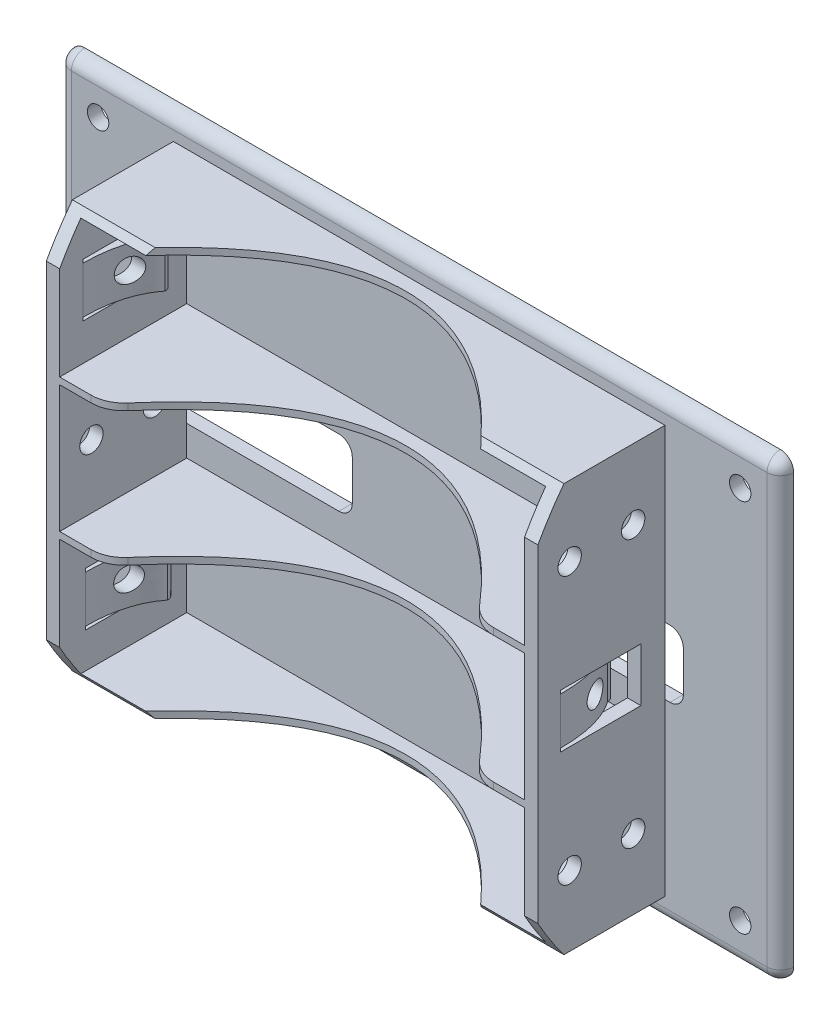
from build123d import *

# Parameters (mm, degrees)
SZKIC1_W                        = 108
SZKIC1_H                        = 68
DODANIE_WYCI_GNI_CIE1_DEPTH     = 2
SZKIC2_W                        = 69.5
SZKIC2_H                        = 1
DODANIE_WYCI_GNI_CIE2_DEPTH     = 19
SZKIC4_W                        = 12
SZKIC4_H                        = 8
WYTNIJ_WYCI_GNI_CIE1_DEPTH      = 2
SZKIC5_W                        = 12
SZKIC5_H                        = 8
WYTNIJ_WYCI_GNI_CIE2_DEPTH      = 2
DODANIE_WYCI_GNI_CIE3_START     = 0.5
DODANIE_WYCI_GNI_CIE3_DEPTH     = 7
DODANIE_WYCI_GNI_CIE4_START     = 0.5
DODANIE_WYCI_GNI_CIE4_DEPTH     = 7
DODANIE_WYCI_GNI_CIE5_START     = 0.5
DODANIE_WYCI_GNI_CIE5_DEPTH     = 7
WYTNIJ_WYCI_GNI_CIE3_DEPTH      = 67
ZAOKR_GLENIE2_R                 = 5
WYTNIJ_WYCI_GNI_CIE5_DEPTH      = 10
WYTNIJ_WYCI_GNI_CIE5_DEPTH_BACK = 10
SZKIC10_R                       = 1.75
WYTNIJ_WYCI_GNI_CIE6_DEPTH      = 10
WYTNIJ_WYCI_GNI_CIE6_DEPTH_BACK = 10
SZKIC11_R                       = 1.75
SZKIC13_W                       = 29.5
SZKIC13_H                       = 10
SZKIC13_R                       = 1.6
WYTNIJ_WYCI_GNI_CIE7_DEPTH      = 2
ZAOKR_GLENIE4_R                 = 2
WYTNIJ_WYCI_GNI_CIE8_START      = -90.75
WYTNIJ_WYCI_GNI_CIE8_DEPTH      = 108


with BuildPart() as part:
    # Szkic1 → Dodanie-wyciągnięcie1 (new body)
    with BuildSketch(Plane.XY):
        with Locations((19.733950025, 34.841198491)):
            Rectangle(SZKIC1_W, SZKIC1_H)
    extrude(amount=DODANIE_WYCI_GNI_CIE1_DEPTH)

    # Szkic2 → Dodanie-wyciągnięcie2 (add)
    with BuildSketch(Plane.XY.offset(2)):
        Polygon((-17.016049975, 65.341198491), (-15.016049975, 65.341198491), (-15.016049975, 64.341198491), (-15.016049975, 45.341198491), (-15.016049975, 44.341198491), (-15.016049975, 34.841198491), (-15.016049975, 25.341198491), (-15.016049975, 24.341198491), (-15.016049975, 5.341198491), (-15.016049975, 4.341198491), (-17.016049975, 4.341198491), align=None)
        Polygon((56.483950025, 4.341198491), (56.483950025, 65.341198491), (54.483950025, 65.341198491), (54.483950025, 64.341198491), (54.483950025, 45.341198491), (54.483950025, 44.341198491), (54.483950025, 34.841198491), (54.483950025, 25.341198491), (54.483950025, 24.341198491), (54.483950025, 5.341198491), (54.483950025, 4.341198491), align=None)
        with Locations((19.733950025, 44.841198491)):
            Rectangle(SZKIC2_W, SZKIC2_H)
        with Locations((19.733950025, 64.841198491)):
            Rectangle(SZKIC2_W, SZKIC2_H)
        with Locations((19.733950025, 24.841198491)):
            Rectangle(SZKIC2_W, SZKIC2_H)
        with Locations((19.733950025, 4.841198491)):
            Rectangle(SZKIC2_W, SZKIC2_H)
    extrude(amount=DODANIE_WYCI_GNI_CIE2_DEPTH)

    # Szkic4 → Wytnij-wyciągnięcie1 (cut)
    with BuildSketch(Plane(origin=(-15.016049975, 0, 0), x_dir=(0, 0, -1), z_dir=(1, 0, 0))):
        with Locations((-11.5, 54.841198491)):
            Rectangle(SZKIC4_W, SZKIC4_H)
        with Locations((-11.1, 14.641198491)):
            Rectangle(SZKIC4_W, SZKIC4_H)
    extrude(amount=-WYTNIJ_WYCI_GNI_CIE1_DEPTH, mode=Mode.SUBTRACT)

    # Szkic5 → Wytnij-wyciągnięcie2 (cut)
    with BuildSketch(Plane.ZY.offset(-54.483950025)):
        with Locations((11.6, 34.841198491)):
            Rectangle(SZKIC5_W, SZKIC5_H)
    extrude(amount=-WYTNIJ_WYCI_GNI_CIE2_DEPTH, mode=Mode.SUBTRACT)

    # Szkic6 → Dodanie-wyciągnięcie3 (add)
    with BuildSketch(Plane.XZ.offset(-58.841198491).offset(DODANIE_WYCI_GNI_CIE3_START)):
        with BuildLine():
            add(Edge.make_bspline(
                [(-17.016049975, 17.5), (-17.016049975, 12.133436854), (-15.016049975, 8.766873708)],
                knots=[0, 0, 0, 0.894427191, 0.894427191, 0.894427191], degree=2))
            Line((-15.016049975, 8.766873708), (-15.016049975, 17.5))
            Line((-15.016049975, 17.5), (-17.016049975, 17.5))
        make_face()
        with BuildLine():
            add(Edge.make_bspline(
                [(-15.016049975, 8.766873708), (-14.779981997, 8.369504832), (-14.516049975, 8)],
                knots=[0.894427191, 0.894427191, 0.894427191, 1, 1, 1], degree=2))
            ThreePointArc((-14.516049975, 8), (-14.032436394, 8.924255625), (-12.997386045, 9.053875567))
            add(Edge.make_bspline(
                [(-15.016049975, 17.5), (-15.016049975, 12.35936327), (-12.997386045, 9.053875567)],
                knots=[0, 0, 0, 0.856772788, 0.856772788, 0.856772788], degree=2))
            Line((-15.016049975, 17.5), (-15.016049975, 8.766873708))
        make_face()
        with BuildLine():
            ThreePointArc((-12.997386045, 9.053875567), (-14.032436394, 8.924255625), (-14.516049975, 8))
            Line((-14.516049975, 8), (-12.266049975, 8))
            add(Edge.make_bspline(
                [(-12.997386045, 9.053875567), (-12.659924807, 8.501295241), (-12.266049975, 8)],
                knots=[0.856772788, 0.856772788, 0.856772788, 1, 1, 1], degree=2))
        make_face()
        with BuildLine():
            Line((-12.266049975, 8), (-14.516049975, 8))
            ThreePointArc((-14.516049975, 8), (-13.391049975, 6.875), (-12.266049975, 8))
        make_face()
    extrude(amount=DODANIE_WYCI_GNI_CIE3_DEPTH)

    # Szkic7 → Dodanie-wyciągnięcie4 (add)
    with BuildSketch(Plane.XZ.offset(-18.641198491).offset(DODANIE_WYCI_GNI_CIE4_START)):
        with BuildLine():
            ThreePointArc((-12.997386045, 8.653875567), (-14.032436394, 8.524255625), (-14.516049975, 7.6))
            Line((-14.516049975, 7.6), (-12.266049975, 7.6))
            add(Edge.make_bspline(
                [(-12.266049975, 7.6), (-12.659924807, 8.101295241), (-12.997386045, 8.653875567)],
                knots=[0, 0, 0, 0.143227212, 0.143227212, 0.143227212], degree=2))
        make_face()
        with BuildLine():
            Line((-12.266049975, 7.6), (-14.516049975, 7.6))
            ThreePointArc((-14.516049975, 7.6), (-13.391049975, 6.475), (-12.266049975, 7.6))
        make_face()
        with BuildLine():
            add(Edge.make_bspline(
                [(-14.516049975, 7.6), (-14.779981997, 7.969504832), (-15.016049975, 8.366873708)],
                knots=[0, 0, 0, 0.105572809, 0.105572809, 0.105572809], degree=2))
            ThreePointArc((-14.516049975, 7.6), (-14.032436394, 8.524255625), (-12.997386045, 8.653875567))
            add(Edge.make_bspline(
                [(-12.997386045, 8.653875567), (-15.016049975, 11.95936327), (-15.016049975, 17.1)],
                knots=[0.143227212, 0.143227212, 0.143227212, 1, 1, 1], degree=2))
            Line((-15.016049975, 17.1), (-15.016049975, 8.366873708))
        make_face()
        with BuildLine():
            add(Edge.make_bspline(
                [(-15.016049975, 8.366873708), (-17.016049975, 11.733436854), (-17.016049975, 17.1)],
                knots=[0.105572809, 0.105572809, 0.105572809, 1, 1, 1], degree=2))
            Line((-15.016049975, 8.366873708), (-15.016049975, 17.1))
            Line((-15.016049975, 17.1), (-17.016049975, 17.1))
        make_face()
    extrude(amount=DODANIE_WYCI_GNI_CIE4_DEPTH)

    # Szkic8 → Dodanie-wyciągnięcie5 (add)
    with BuildSketch(Plane(origin=(0, 30.841198491, 0), x_dir=(1, 0, 0), z_dir=(0, 1, 0)).offset(DODANIE_WYCI_GNI_CIE5_START)):
        with BuildLine():
            add(Edge.make_bspline(
                [(54.483950025, -8.866873708), (54.247882048, -8.469504832), (53.983950025, -8.1)],
                knots=[0.894427191, 0.894427191, 0.894427191, 1, 1, 1], degree=2))
            ThreePointArc((53.983950025, -8.1), (53.500336445, -9.024255625), (52.465286096, -9.153875567))
            add(Edge.make_bspline(
                [(54.483950025, -17.6), (54.483950025, -12.45936327), (52.465286096, -9.153875567)],
                knots=[0, 0, 0, 0.856772788, 0.856772788, 0.856772788], degree=2))
            Line((54.483950025, -17.6), (54.483950025, -8.866873708))
        make_face()
        with BuildLine():
            add(Edge.make_bspline(
                [(56.483950025, -17.6), (56.483950025, -12.233436854), (54.483950025, -8.866873708)],
                knots=[0, 0, 0, 0.894427191, 0.894427191, 0.894427191], degree=2))
            Line((54.483950025, -8.866873708), (54.483950025, -17.6))
            Line((54.483950025, -17.6), (56.483950025, -17.6))
        make_face()
        with BuildLine():
            ThreePointArc((52.465286096, -9.153875567), (53.500336445, -9.024255625), (53.983950025, -8.1))
            Line((53.983950025, -8.1), (51.733950025, -8.1))
            add(Edge.make_bspline(
                [(52.465286096, -9.153875567), (52.127824857, -8.601295241), (51.733950025, -8.1)],
                knots=[0.856772788, 0.856772788, 0.856772788, 1, 1, 1], degree=2))
        make_face()
        with BuildLine():
            Line((51.733950025, -8.1), (53.983950025, -8.1))
            ThreePointArc((53.983950025, -8.1), (52.858950025, -6.975), (51.733950025, -8.1))
        make_face()
    extrude(amount=DODANIE_WYCI_GNI_CIE5_DEPTH)

    # Szkic9 → Wytnij-wyciągnięcie3 (cut)
    with BuildSketch(Plane(origin=(0, 65.341198491, 0), x_dir=(1, 0, 0), z_dir=(0, 1, 0))):
        with BuildLine():
            Line((47.483950025, -21), (-8.016049975, -21))
            add(Edge.make_bspline(
                [(47.483950025, -21), (19.733950025, 13), (-8.016049975, -21)],
                knots=[0, 0, 0, 1, 1, 1], degree=2))
        make_face()
    extrude(amount=-WYTNIJ_WYCI_GNI_CIE3_DEPTH, mode=Mode.SUBTRACT)

    # Zaokrąglenie2
    zaokr_glenie2_edges = [part.edges().sort_by_distance(p)[0] for p in [
        (47.483950025, 64.841198491, 21),
        (-8.016049975, 64.841198491, 21),
        (-8.016049975, 44.841198491, 21),
        (47.483950025, 44.841198491, 21),
        (-8.016049975, 24.841198491, 21),
        (47.483950025, 24.841198491, 21),
        (-8.016049975, 4.841198491, 21),
        (47.483950025, 4.841198491, 21),
    ]]
    fillet(zaokr_glenie2_edges, radius=ZAOKR_GLENIE2_R)

    # Szkic10 → Wytnij-wyciągnięcie5 (cut, two sides: drawn at the far end of the back side and taken through both)
    with BuildSketch(Plane.ZY.offset(-54.483950025).offset(-WYTNIJ_WYCI_GNI_CIE5_DEPTH_BACK)):
        with Locations((6.75, 14.841198491)):
            Circle(SZKIC10_R)
        with Locations((16.25, 14.841198491)):
            Circle(SZKIC10_R)
        with Locations((6.75, 54.841198491)):
            Circle(SZKIC10_R)
        with Locations((16.25, 54.841198491)):
            Circle(SZKIC10_R)
        with Locations(Location((11.5, 34.841198491, 0), (0, 0, 180))):
            Circle(SZKIC10_R)
    extrude(amount=WYTNIJ_WYCI_GNI_CIE5_DEPTH + WYTNIJ_WYCI_GNI_CIE5_DEPTH_BACK, mode=Mode.SUBTRACT)

    # Szkic11 → Wytnij-wyciągnięcie6 (cut, two sides: drawn at the far end of the back side and taken through both)
    with BuildSketch(Plane(origin=(-15.016049975, 0, 0), x_dir=(0, 0, -1), z_dir=(1, 0, 0)).offset(-WYTNIJ_WYCI_GNI_CIE6_DEPTH_BACK)):
        with Locations(Location((-11.5, 54.841198491, 0), (0, 0, 180))):
            Circle(SZKIC11_R)
        with Locations(Location((-11.5, 14.841198491, 0), (0, 0, 180))):
            Circle(SZKIC11_R)
        with Locations(Location((-6.75, 34.841198491, 0), (0, 0, 180))):
            Circle(SZKIC11_R)
        with Locations(Location((-16.25, 34.841198491, 0), (0, 0, 180))):
            Circle(SZKIC11_R)
    extrude(amount=WYTNIJ_WYCI_GNI_CIE6_DEPTH + WYTNIJ_WYCI_GNI_CIE6_DEPTH_BACK, mode=Mode.SUBTRACT)

    # Szkic13 → Wytnij-wyciągnięcie7 (cut)
    with BuildSketch(Plane(origin=(0, 0, 0), x_dir=(-1, 0, 0), z_dir=(0, 0, -1))):
        with Locations((-44.483950025, 34.841198491)):
            Rectangle(SZKIC13_W, SZKIC13_H)
        with Locations((5.016049975, 34.841198491)):
            Rectangle(SZKIC13_W, SZKIC13_H)
        with Locations((-67.733950025, 62.841198491)):
            Circle(SZKIC13_R)
        with Locations((-67.733950025, 6.841198491)):
            Circle(SZKIC13_R)
        with Locations((28.266049975, 6.841198491)):
            Circle(SZKIC13_R)
        with Locations((28.266049975, 62.841198491)):
            Circle(SZKIC13_R)
    extrude(amount=-WYTNIJ_WYCI_GNI_CIE7_DEPTH, mode=Mode.SUBTRACT)

    # Zaokrąglenie4
    zaokr_glenie4_edges = [part.edges().sort_by_distance(p)[0] for p in [
        (73.733950025, 34.841198491, 2),
        (19.733950025, 68.841198491, 2),
        (9.733950025, 39.841198491, 1),
        (-19.766049975, 39.841198491, 1),
        (-19.766049975, 29.841198491, 1),
        (9.733950025, 29.841198491, 1),
        (29.733950025, 39.841198491, 1),
        (29.733950025, 29.841198491, 1),
        (59.233950025, 29.841198491, 1),
        (59.233950025, 39.841198491, 1),
        (-34.266049975, 34.841198491, 2),
        (-34.266049975, 68.841198491, 1),
        (73.733950025, 68.841198491, 1),
        (73.733950025, 0.841198491, 1),
        (-34.266049975, 0.841198491, 1),
        (19.733950025, 0.841198491, 2),
    ]]
    fillet(zaokr_glenie4_edges, radius=ZAOKR_GLENIE4_R - 0.0001)  # a hair under: the kernel refuses the full size

    # Szkic14 → Wytnij-wyciągnięcie8 (cut)
    with BuildSketch(Plane(origin=(56.483950025, 0, 0), x_dir=(0, 0, -1), z_dir=(1, 0, 0)).offset(WYTNIJ_WYCI_GNI_CIE8_START)):
        with BuildLine():
            Line((-17.099223595, 65.341198491), (-19.581721238, 65.341198491))
            ThreePointArc((-19.581721238, 65.341198491), (-20.3034492, 64.303848621), (-21, 63.249427933))
            Line((-21, 63.249427933), (-21, 59.357060703))
            ThreePointArc((-21, 59.357060703), (-19.155551788, 62.418186867), (-17.099223595, 65.341198491))
        make_face()
        with BuildLine():
            ThreePointArc((-21, 63.249427933), (-20.3034492, 64.303848621), (-19.581721238, 65.341198491))
            Line((-19.581721238, 65.341198491), (-21, 65.341198491))
            Line((-21, 65.341198491), (-21, 63.249427933))
        make_face()
        with BuildLine():
            ThreePointArc((-21, 6.43296905), (-20.3034492, 5.378548362), (-19.581721238, 4.341198491))
            Line((-19.581721238, 4.341198491), (-17.099223595, 4.341198491))
            ThreePointArc((-17.099223595, 4.341198491), (-19.155551788, 7.264210116), (-21, 10.325336279))
            Line((-21, 10.325336279), (-21, 6.43296905))
        make_face()
        with BuildLine():
            Line((-21, 4.341198491), (-19.581721238, 4.341198491))
            ThreePointArc((-19.581721238, 4.341198491), (-20.3034492, 5.378548362), (-21, 6.43296905))
            Line((-21, 6.43296905), (-21, 4.341198491))
        make_face()
    extrude(amount=WYTNIJ_WYCI_GNI_CIE8_DEPTH, mode=Mode.SUBTRACT)


solid = part.part
